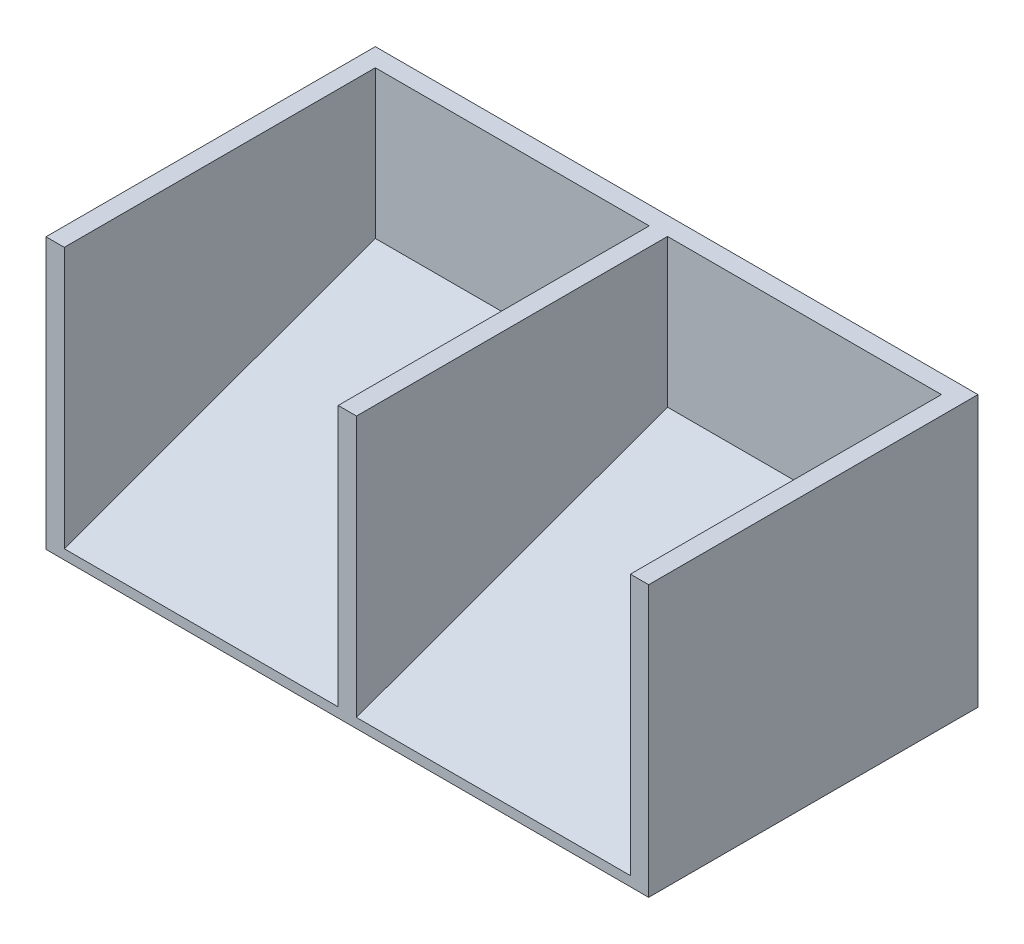
from build123d import *

# Parameters (mm, degrees)
SKETCH1_W            = 209.169
SKETCH1_H            = 114.3
BOX_DEPTH            = 93.98
CUT_EXTRUDE1_REACH   = 153.777
SKETCH2_W            = 95.0595
SKETCH2_H            = 107.95
CUT_EXTRUDE2_START   = -98.2345
CUT_EXTRUDE2_DEPTH   = 95.0595
CUT_EXTRUDE2_START_2 = 3.175
CUT_EXTRUDE2_2_DEPTH = 95.0595


# Read off the part's stored shape, not the designer's step: Cut-Extrude2
with BuildPart() as part:
    # Sketch1 → Box (new body)
    with BuildSketch(Plane(origin=(0, 0, 0), x_dir=(1, 0, 0), z_dir=(0, 1, 0))):
        Rectangle(SKETCH1_W, SKETCH1_H)
    extrude(amount=BOX_DEPTH)

    # Cut-Extrude1: up to this plane
    cut_extrude1_end = Plane(origin=(0, 21.351180018, 7.771193993), z_dir=(0, -0.9396926207859081, -0.34202014332566943))
    # Sketch2 → Cut-Extrude1 (cut, up to the surface)
    with BuildSketch(Plane(origin=(0, 93.98, 0), x_dir=(1, 0, 0), z_dir=(0, 1, 0)), mode=Mode.PRIVATE) as cut_extrude1_sk1:
        with Locations((-50.70475, -3.175)):
            Rectangle(SKETCH2_W, SKETCH2_H)
    cut_extrude1_tool1 = split(extrude(cut_extrude1_sk1.sketch, amount=-CUT_EXTRUDE1_REACH, mode=Mode.PRIVATE), bisect_by=cut_extrude1_end, keep=Keep.BOTH, mode=Mode.PRIVATE)
    add(cut_extrude1_tool1.solids().sort_by_distance((-50.70475, 93.98, 3.175))[0], mode=Mode.SUBTRACT)
    # Sketch2 → Cut-Extrude1 (cut, up to the surface)
    with BuildSketch(Plane(origin=(0, 93.98, 0), x_dir=(1, 0, 0), z_dir=(0, 1, 0)), mode=Mode.PRIVATE) as cut_extrude1_sk2:
        with Locations((50.70475, -3.175)):
            Rectangle(SKETCH2_W, SKETCH2_H)
    cut_extrude1_tool2 = split(extrude(cut_extrude1_sk2.sketch, amount=-CUT_EXTRUDE1_REACH, mode=Mode.PRIVATE), bisect_by=cut_extrude1_end, keep=Keep.BOTH, mode=Mode.PRIVATE)
    add(cut_extrude1_tool2.solids().sort_by_distance((50.70475, 93.98, 3.175))[0], mode=Mode.SUBTRACT)

    # Cut-Extrude2 outline → Cut-Extrude2 (cut)
    with BuildSketch(Plane.YZ.offset(CUT_EXTRUDE2_START)):
        Polygon((0, 57.15), (0, -50.8), (39.290586789, -50.8), align=None)
    extrude(amount=CUT_EXTRUDE2_DEPTH, mode=Mode.SUBTRACT)

    # Cut-Extrude2 2 outline → Cut-Extrude2 2 (cut)
    with BuildSketch(Plane.YZ.offset(CUT_EXTRUDE2_START_2)):
        Polygon((0, 57.15), (0, -50.8), (39.290586789, -50.8), align=None)
    extrude(amount=CUT_EXTRUDE2_2_DEPTH, mode=Mode.SUBTRACT)


solid = part.part
